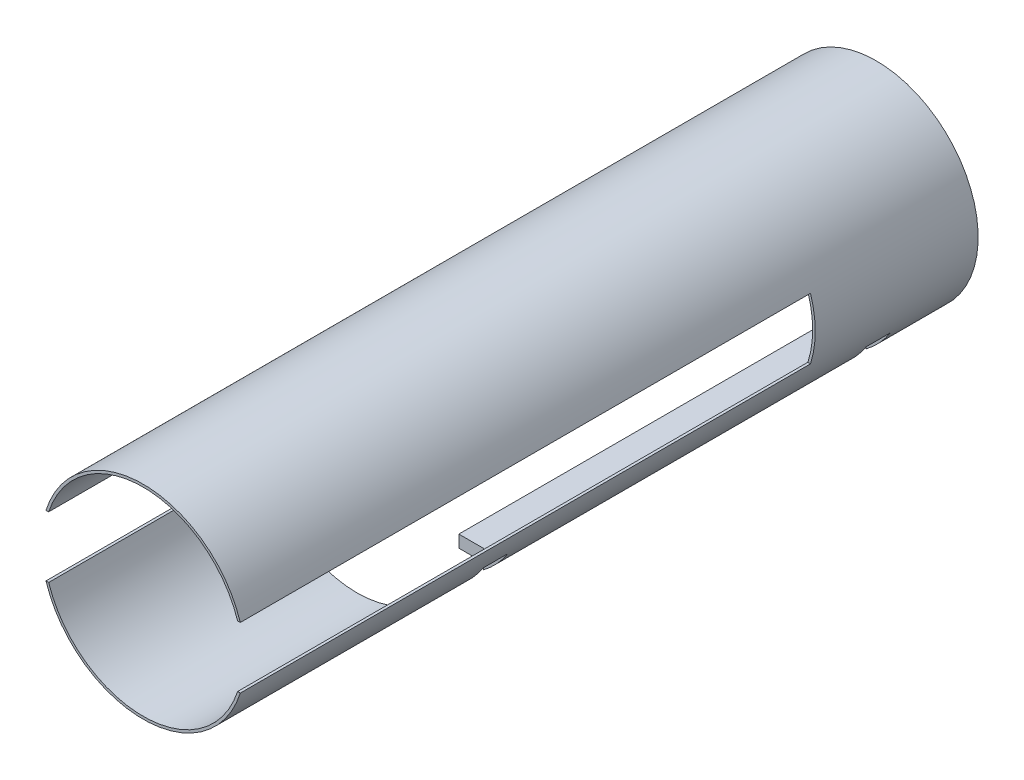
from build123d import *
from build123d.topology import SkipClean

# Parameters (mm, degrees)
BOSS_EXTRUDE1_DEPTH             = 177.8
BOSS_EXTRUDE1_2_DEPTH           = 177.8
SKETCH2_R                       = 63.5
SKETCH2_R_2                     = 61.9125
BOSS_EXTRUDE2_DEPTH             = 101.6
BOSS_EXTRUDE3_START             = -12.7
SKETCH3_R                       = 61.9125
SKETCH3_R_2                     = 31.75
BOSS_EXTRUDE3_DEPTH             = 12.7
F_1_4_0_25_DIAMETER_HOLE1_D     = 6.35
F_1_4_0_25_DIAMETER_HOLE1_DEPTH = 44.958
CUT_EXTRUDE1_START              = -44.4500001
CUT_EXTRUDE1_DEPTH              = 32.0675001
BOSS_EXTRUDE6_REACH             = 449.258
SKETCH7_W                       = 15.24
SKETCH7_H                       = 7.62
SKETCH8_R                       = 2.54
CUT_EXTRUDE2_DEPTH              = 5.08


# Read off the part's stored shape, not the designer's step: Cut-Extrude1
with BuildPart() as part:
    # Sketch1 → Boss-Extrude1 (new, symmetric)
    with BuildSketch(Plane.XY):
        with BuildLine():
            ThreePointArc((60.57513929, 19.05), (0, 63.5), (-60.57513929, 19.05))
            Line((-60.57513929, 19.05), (-58.908871626, 19.05))
            ThreePointArc((-58.908871626, 19.05), (0, 61.9125), (58.908871626, 19.05))
            Line((58.908871626, 19.05), (60.57513929, 19.05))
        make_face()
    extrude(amount=BOSS_EXTRUDE1_DEPTH, both=True)



with BuildPart() as body_2:
    # Sketch1 → Boss-Extrude1 2 (new, symmetric)
    with BuildSketch(Plane.XY):
        with BuildLine():
            Line((-58.908871626, -19.05), (-60.57513929, -19.05))
            ThreePointArc((-60.57513929, -19.05), (0, -63.5), (60.57513929, -19.05))
            Line((60.57513929, -19.05), (58.908871626, -19.05))
            ThreePointArc((58.908871626, -19.05), (0, -61.9125), (-58.908871626, -19.05))
        make_face()
    extrude(amount=BOSS_EXTRUDE1_2_DEPTH, both=True)


with BuildPart() as part_1:
    with SkipClean():  # the faces are left unmerged after this step: merging them gives an invalid solid
        add(part.part)

        add(body_2.part)  # Boss-Extrude2 merges body 2
        # Sketch2 → Boss-Extrude2 (add)
        with BuildSketch(Plane(origin=(0, 0, -177.8), x_dir=(-1, 0, 0), z_dir=(0, 0, -1))):
            Circle(SKETCH2_R)
            Circle(SKETCH2_R_2, mode=Mode.SUBTRACT)
        extrude(amount=BOSS_EXTRUDE2_DEPTH)

    # Sketch3 → Boss-Extrude3 (add)
    with SkipClean():  # the faces are left unmerged after this step: merging them gives an invalid solid
        with BuildSketch(Plane(origin=(0, 0, -273.05), x_dir=(-1, 0, 0), z_dir=(0, 0, -1)).offset(BOSS_EXTRUDE3_START)):
            Circle(SKETCH3_R)
            Circle(SKETCH3_R_2, mode=Mode.SUBTRACT)
        extrude(amount=BOSS_EXTRUDE3_DEPTH)

    # 1/4 (0.25) Diameter Hole1
    with Locations(Plane(origin=(0, 44.45, -273.05), x_dir=(-1, 0, 0), z_dir=(0, 0, -1))):
        with Locations((0, 0), (44.45, -44.45), (0, -88.9), (-44.45, -44.45)):
            Hole(F_1_4_0_25_DIAMETER_HOLE1_D / 2, depth=F_1_4_0_25_DIAMETER_HOLE1_DEPTH)

    # Cut-Extrude1 outline → Cut-Extrude1 (cut)
    with BuildSketch(Plane(origin=(0, -19.05, 0), x_dir=(1, 0, 0), z_dir=(0, 1, 0)).offset(CUT_EXTRUDE1_START)):
        Polygon((-53.34, 219.71), (-38.1, 219.71), (-38.1, -3.81), (-53.34, -3.81), (-53.34, -19.05), (-38.1, -19.05), (-38.1, -44.45), (38.1, -44.45), (38.1, -19.05), (53.34, -19.05), (53.34, -3.81), (38.1, -3.81), (38.1, 219.71), (53.34, 219.71), (53.34, 234.95), (38.1, 234.95), (38.1, 260.35), (-38.1, 260.35), (-38.1, 234.95), (-53.34, 234.95), align=None)
    extrude(amount=CUT_EXTRUDE1_DEPTH, mode=Mode.SUBTRACT)

    # Boss-Extrude6: up to this face of the body (flat: up to its plane)
    boss_extrude6_end = Plane(part_1.part.faces().sort_by_distance((-46.232796628, -41.83821412, 19.05))[0])
    # Sketch7 → Boss-Extrude6 (add, up to the picked face)
    with BuildSketch(Plane.XY.offset(-260.35), mode=Mode.PRIVATE) as boss_extrude6_sk1:
        with BuildLine():
            ThreePointArc((53.34, -31.4325), (55.376223463, -27.688111731), (57.15, -23.8125))
            Line((57.15, -23.8125), (53.34, -23.8125))
            Line((53.34, -23.8125), (53.34, -31.4325))
        make_face()
    boss_extrude6_tool1 = split(extrude(boss_extrude6_sk1.sketch, amount=BOSS_EXTRUDE6_REACH, mode=Mode.PRIVATE), bisect_by=boss_extrude6_end, keep=Keep.BOTH, mode=Mode.PRIVATE)
    # Sketch7 → Boss-Extrude6 (add, up to the picked face)
    with BuildSketch(Plane.XY.offset(-260.35), mode=Mode.PRIVATE) as boss_extrude6_sk2:
        with Locations((45.72, -27.6225)):
            Rectangle(SKETCH7_W, SKETCH7_H)
    boss_extrude6_tool2 = split(extrude(boss_extrude6_sk2.sketch, amount=BOSS_EXTRUDE6_REACH, mode=Mode.PRIVATE), bisect_by=boss_extrude6_end, keep=Keep.BOTH, mode=Mode.PRIVATE)
    # Sketch7 → Boss-Extrude6 (add, up to the picked face)
    with BuildSketch(Plane.XY.offset(-260.35), mode=Mode.PRIVATE) as boss_extrude6_sk3:
        with BuildLine():
            Line((-53.34, -31.4325), (-53.34, -23.8125))
            Line((-53.34, -23.8125), (-57.15, -23.8125))
            ThreePointArc((-57.15, -23.8125), (-55.376223463, -27.688111731), (-53.34, -31.4325))
        make_face()
    boss_extrude6_tool3 = split(extrude(boss_extrude6_sk3.sketch, amount=BOSS_EXTRUDE6_REACH, mode=Mode.PRIVATE), bisect_by=boss_extrude6_end, keep=Keep.BOTH, mode=Mode.PRIVATE)
    # Sketch7 → Boss-Extrude6 (add, up to the picked face)
    with BuildSketch(Plane.XY.offset(-260.35), mode=Mode.PRIVATE) as boss_extrude6_sk4:
        with Locations((-45.72, -27.6225)):
            Rectangle(SKETCH7_W, SKETCH7_H)
    boss_extrude6_tool4 = split(extrude(boss_extrude6_sk4.sketch, amount=BOSS_EXTRUDE6_REACH, mode=Mode.PRIVATE), bisect_by=boss_extrude6_end, keep=Keep.BOTH, mode=Mode.PRIVATE)
    add(boss_extrude6_tool1.solids().sort_by(Axis((54.64733, -26.422885, -260.35), (0, 0, 1)))[0])
    add(boss_extrude6_tool2.solids().sort_by(Axis((45.72, -27.6225, -260.35), (0, 0, 1)))[0])
    add(boss_extrude6_tool3.solids().sort_by(Axis((-54.64733, -26.422885, -260.35), (0, 0, 1)))[0])
    add(boss_extrude6_tool4.solids().sort_by(Axis((-45.72, -27.6225, -260.35), (0, 0, 1)))[0])

    # Sketch8 → Cut-Extrude2 (cut)
    with SkipClean():  # the faces are left unmerged after this step: merging them gives an invalid solid
        with BuildSketch(Plane.XZ.offset(31.4325)):
            with Locations((-45.72, 11.352572264)):
                Circle(SKETCH8_R)
            with Locations((-45.72, -227.33)):
                Circle(SKETCH8_R)
            with Locations(Location((45.72, 11.352572264, 0), (0, 0, 180))):
                Circle(SKETCH8_R)
            with Locations(Location((45.72, -227.33, 0), (0, 0, 180))):
                Circle(SKETCH8_R)
        extrude(amount=-CUT_EXTRUDE2_DEPTH, mode=Mode.SUBTRACT)


solid = part_1.part
